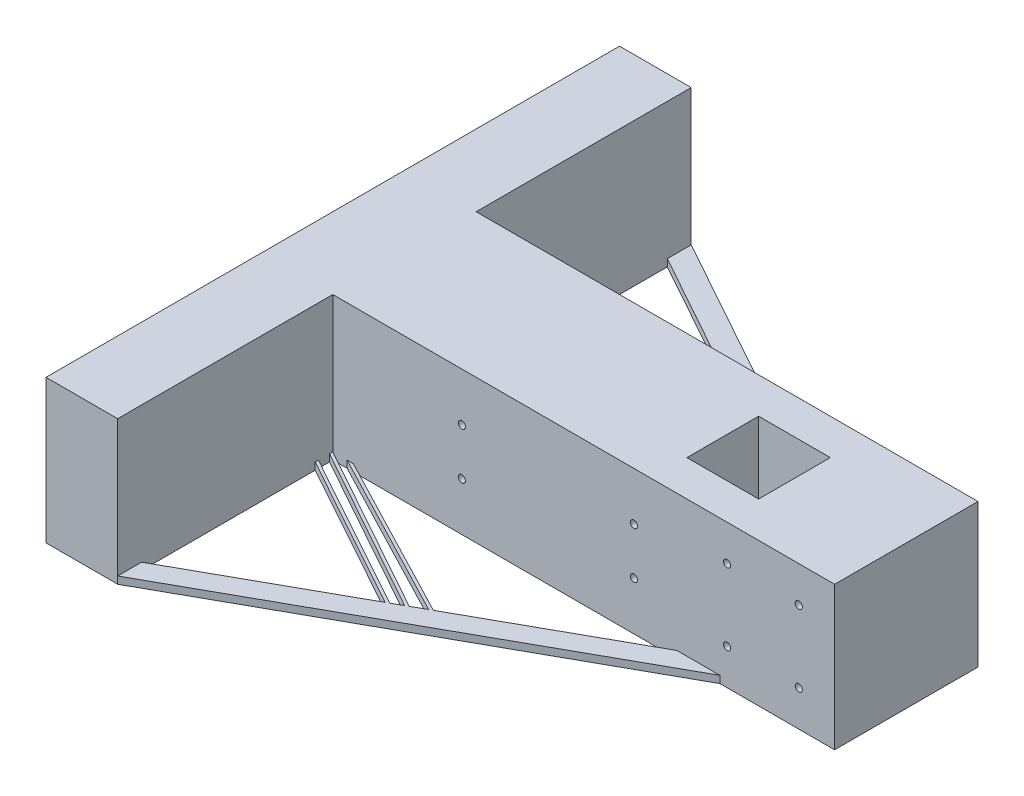
from build123d import *

# Parameters (mm, degrees)
SKETCH2_W                   = 508
SKETCH2_H                   = 127
BOSS_EXTRUDE1_DEPTH         = 63.5
SKETCH3_W                   = 127
SKETCH3_H                   = 127
BOSS_EXTRUDE2_DEPTH         = 444.5
SKETCH4_W                   = 31.75
SKETCH4_H                   = 31.75
CUT_EXTRUDE1_DEPTH          = 38.1
SKETCH5_R                   = 12.7
CUT_EXTRUDE2_DEPTH          = 50.8
SKETCH6_W                   = 63.5
SKETCH6_H                   = 63.5
CUT_EXTRUDE3_DEPTH          = 63.5
F_1_4_0_25_DIAMETER_HOLE1_D = 6.35
BOSS_EXTRUDE3_DEPTH         = 6.35
EXTRUDE_THIN1_START         = -6.35
EXTRUDE_THIN1_DEPTH         = 6.35
SKETCH12_R                  = 3.175
CUT_EXTRUDE4_DEPTH          = 603.413894262


# Read off the part's stored shape, not the designer's step: Extrude-Thin1
with BuildPart() as part:
    # Sketch2 → Boss-Extrude1 (new body)
    with BuildSketch(Plane(origin=(0, 0, 0), x_dir=(0, 0, -1), z_dir=(1, 0, 0))):
        Rectangle(SKETCH2_W, SKETCH2_H)
    extrude(amount=BOSS_EXTRUDE1_DEPTH)

    # Sketch3 → Boss-Extrude2 (add)
    with BuildSketch(Plane(origin=(63.5, 0, 0), x_dir=(0, 0, -1), z_dir=(1, 0, 0))):
        Rectangle(SKETCH3_W, SKETCH3_H)
    extrude(amount=BOSS_EXTRUDE2_DEPTH)

    # Sketch4 → Cut-Extrude1 (cut)
    with BuildSketch(Plane.ZY):
        Rectangle(SKETCH4_W, SKETCH4_H)
    extrude(amount=-CUT_EXTRUDE1_DEPTH, mode=Mode.SUBTRACT)

    # Sketch5 → Cut-Extrude2 (cut)
    with BuildSketch(Plane.ZY.offset(-38.1)):
        Circle(SKETCH5_R)
    extrude(amount=-CUT_EXTRUDE2_DEPTH, mode=Mode.SUBTRACT)

    # Sketch6 → Cut-Extrude3 (cut)
    with BuildSketch(Plane(origin=(0, 63.5, 0), x_dir=(1, 0, 0), z_dir=(0, 1, 0))):
        with Locations((377.19, 0)):
            Rectangle(SKETCH6_W, SKETCH6_H)
    extrude(amount=-CUT_EXTRUDE3_DEPTH, mode=Mode.SUBTRACT)

    # 1/4 (0.25) Diameter Hole1 (through all)
    with Locations(Plane.XY.offset(63.5)):
        with Locations((476.25, -31.75), (412.75, -31.75), (412.75, 31.75), (476.25, 31.75)):
            Hole(F_1_4_0_25_DIAMETER_HOLE1_D / 2)

    # Sketch10 → Boss-Extrude3 (add)
    with BuildSketch(Plane.XZ.offset(63.5)):
        Polygon((63.5, 254), (406.4, 63.5), (368.3, 63.5), (63.5, 232.833333333), align=None)
    boss_extrude3 = extrude(amount=-BOSS_EXTRUDE3_DEPTH)

    # Mirror1: Boss-Extrude3 across plane
    add(boss_extrude3.mirror(Plane.XY))

    # Extrude-Thin1 outline → Extrude-Thin1 (add)
    with BuildSketch(Plane(origin=(0, -57.15, 0), x_dir=(1, 0, 0), z_dir=(0, 1, 0)).offset(EXTRUDE_THIN1_START)):
        Polygon((81.701018612, -63.5), (76.2, -63.5), (227.001797407, -141.999001441), (229.66281775, -140.520656806), align=None)
        Polygon((215.9, -148.166666667), (63.5, -63.5), (63.5, -66.405655618), (213.284909944, -149.619494475), align=None)
        Polygon((204.798202593, -154.334331893), (63.5, -76.2), (63.5, -79.10247771), (202.17989093, -155.788949483), align=None)
    extrude_thin1 = extrude(amount=EXTRUDE_THIN1_DEPTH)

    # Mirror2: Extrude-Thin1 across plane
    add(extrude_thin1.mirror(Plane.XY))

    # Sketch12 → Cut-Extrude4 (cut, through all)
    with BuildSketch(Plane.XY.offset(63.5)):
        with Locations((177.8, 20.701)):
            Circle(SKETCH12_R)
        with Locations((177.8, -20.701)):
            Circle(SKETCH12_R)
        with Locations((330.2, 20.701)):
            Circle(SKETCH12_R)
        with Locations((330.2, -20.701)):
            Circle(SKETCH12_R)
    extrude(amount=-CUT_EXTRUDE4_DEPTH, mode=Mode.SUBTRACT)


solid = part.part
